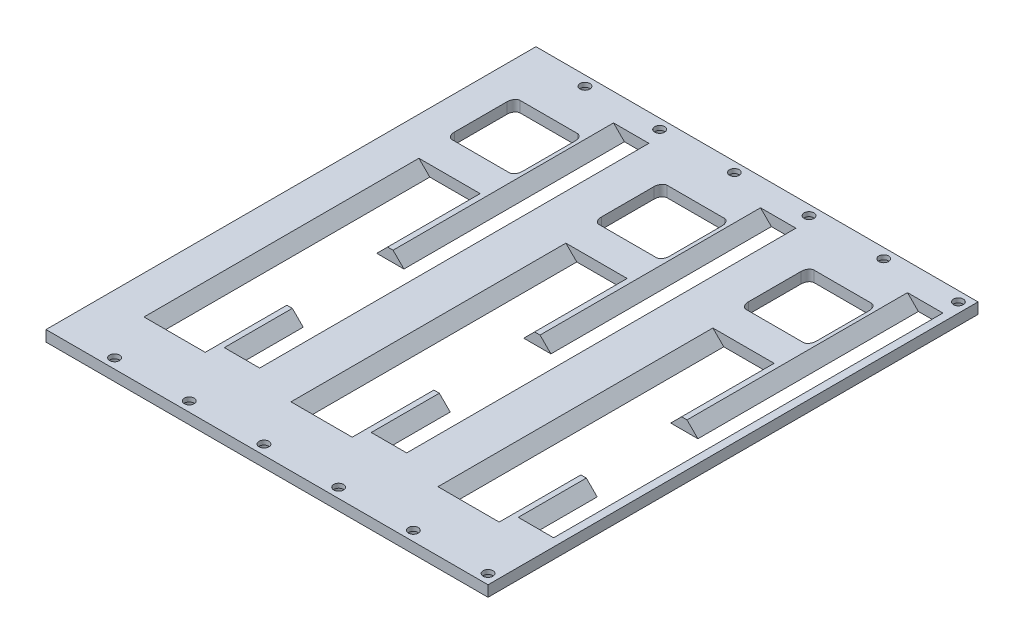
from build123d import *

# Parameters (mm, degrees)
SZKIC1_W                                          = 162.4
SZKIC1_H                                          = 180
DODANIE_WYCI_GNI_CIE1_DEPTH                       = 4
WYTNIJ_WYCI_GNI_CIE1_REACH                        = 123.282
SFAZOWANIE1_SIZE                                  = 4
POG_BIENIE_WALCOWE_POD_M3_RUB_Z_BEM_S_D           = 3.6
POG_BIENIE_WALCOWE_POD_M3_RUB_Z_BEM_S_DEPTH       = 6.7
POG_BIENIE_WALCOWE_POD_M3_RUB_Z_BEM_S_CBORE_D     = 7
POG_BIENIE_WALCOWE_POD_M3_RUB_Z_BEM_S_CBORE_DEPTH = 2.4
POG_BIENIE_WALCOWE_POD_M3_RUB_Z_BEM_S_TIP         = 1.081549114


with BuildPart() as part:
    # Szkic1 → Dodanie-wyciągnięcie1 (new body)
    with BuildSketch(Plane(origin=(0, 0, 0), x_dir=(1, 0, 0), z_dir=(0, 1, 0))):
        Rectangle(SZKIC1_W, SZKIC1_H)
    extrude(amount=DODANIE_WYCI_GNI_CIE1_DEPTH)

    # Szkic2 → Wytnij-wyciągnięcie1 (cut, up to next)
    with BuildSketch(Plane.XZ, mode=Mode.PRIVATE) as wytnij_wyci_gni_cie1_sk1:
        with BuildLine():
            Line((-44, -47.828427125), (-44, -67.171572875))
            add(Edge.make_bspline(
                [(-46, -70), (-44, -70), (-44, -67.171572875)],
                knots=[3.141592654, 3.141592654, 3.141592654, 4.71238898, 4.71238898, 4.71238898], degree=2, weights=[1, 0.707106781, 1]))
            Line((-46, -70), (-67, -70))
            add(Edge.make_bspline(
                [(-69, -67.171572875), (-69, -70), (-67, -70)],
                knots=[1.570796327, 1.570796327, 1.570796327, 3.141592654, 3.141592654, 3.141592654], degree=2, weights=[1, 0.707106781, 1]))
            Line((-69, -67.171572875), (-69, -47.828427125))
            add(Edge.make_bspline(
                [(-67, -45), (-69, -45), (-69, -47.828427125)],
                knots=[0, 0, 0, 1.570796327, 1.570796327, 1.570796327], degree=2, weights=[1, 0.707106781, 1]))
            Line((-67, -45), (-46, -45))
            add(Edge.make_bspline(
                [(-44, -47.828427125), (-44, -45), (-46, -45)],
                knots=[4.71238898, 4.71238898, 4.71238898, 6.283185307, 6.283185307, 6.283185307], degree=2, weights=[1, 0.707106781, 1]))
        make_face()
    wytnij_wyci_gni_cie1_tool1 = extrude(wytnij_wyci_gni_cie1_sk1.sketch, amount=-WYTNIJ_WYCI_GNI_CIE1_REACH, mode=Mode.PRIVATE) & part.part
    # Szkic2 → Wytnij-wyciągnięcie1 (cut, up to next)
    with BuildSketch(Plane.XZ, mode=Mode.PRIVATE) as wytnij_wyci_gni_cie1_sk2:
        with BuildLine():
            Line((10, -47.828427125), (10, -67.171572875))
            add(Edge.make_bspline(
                [(8, -70), (10, -70), (10, -67.171572875)],
                knots=[3.141592654, 3.141592654, 3.141592654, 4.71238898, 4.71238898, 4.71238898], degree=2, weights=[1, 0.707106781, 1]))
            Line((8, -70), (-13, -70))
            add(Edge.make_bspline(
                [(-15, -67.171572875), (-15, -70), (-13, -70)],
                knots=[1.570796327, 1.570796327, 1.570796327, 3.141592654, 3.141592654, 3.141592654], degree=2, weights=[1, 0.707106781, 1]))
            Line((-15, -67.171572875), (-15, -47.828427125))
            add(Edge.make_bspline(
                [(-13, -45), (-15, -45), (-15, -47.828427125)],
                knots=[0, 0, 0, 1.570796327, 1.570796327, 1.570796327], degree=2, weights=[1, 0.707106781, 1]))
            Line((-13, -45), (8, -45))
            add(Edge.make_bspline(
                [(10, -47.828427125), (10, -45), (8, -45)],
                knots=[4.71238898, 4.71238898, 4.71238898, 6.283185307, 6.283185307, 6.283185307], degree=2, weights=[1, 0.707106781, 1]))
        make_face()
    wytnij_wyci_gni_cie1_tool2 = extrude(wytnij_wyci_gni_cie1_sk2.sketch, amount=-WYTNIJ_WYCI_GNI_CIE1_REACH, mode=Mode.PRIVATE) & part.part
    # Szkic2 → Wytnij-wyciągnięcie1 (cut, up to next)
    with BuildSketch(Plane.XZ, mode=Mode.PRIVATE) as wytnij_wyci_gni_cie1_sk3:
        Polygon((-9.2, -33), (5.3, -33), (5.3, 1), (15.3, 1), (15.3, -80), (20.3, -80), (20.3, 63), (15.3, 63), (15.3, 38), (5.3, 38), (5.3, 68), (-9.2, 68), align=None)
    wytnij_wyci_gni_cie1_tool3 = extrude(wytnij_wyci_gni_cie1_sk3.sketch, amount=-WYTNIJ_WYCI_GNI_CIE1_REACH, mode=Mode.PRIVATE) & part.part
    # Szkic2 → Wytnij-wyciągnięcie1 (cut, up to next)
    with BuildSketch(Plane.XZ, mode=Mode.PRIVATE) as wytnij_wyci_gni_cie1_sk4:
        Polygon((-63.2, -33), (-48.7, -33), (-48.7, 1), (-38.7, 1), (-38.7, -80), (-33.7, -80), (-33.7, 63), (-38.7, 63), (-38.7, 38), (-48.7, 38), (-48.7, 68), (-63.2, 68), align=None)
    wytnij_wyci_gni_cie1_tool4 = extrude(wytnij_wyci_gni_cie1_sk4.sketch, amount=-WYTNIJ_WYCI_GNI_CIE1_REACH, mode=Mode.PRIVATE) & part.part
    # Szkic2 → Wytnij-wyciągnięcie1 (cut, up to next)
    with BuildSketch(Plane.XZ, mode=Mode.PRIVATE) as wytnij_wyci_gni_cie1_sk5:
        with BuildLine():
            Line((64, -47.828427125), (64, -67.171572875))
            add(Edge.make_bspline(
                [(62, -70), (64, -70), (64, -67.171572875)],
                knots=[3.141592654, 3.141592654, 3.141592654, 4.71238898, 4.71238898, 4.71238898], degree=2, weights=[1, 0.707106781, 1]))
            Line((62, -70), (41, -70))
            add(Edge.make_bspline(
                [(39, -67.171572875), (39, -70), (41, -70)],
                knots=[1.570796327, 1.570796327, 1.570796327, 3.141592654, 3.141592654, 3.141592654], degree=2, weights=[1, 0.707106781, 1]))
            Line((39, -67.171572875), (39, -47.828427125))
            add(Edge.make_bspline(
                [(41, -45), (39, -45), (39, -47.828427125)],
                knots=[0, 0, 0, 1.570796327, 1.570796327, 1.570796327], degree=2, weights=[1, 0.707106781, 1]))
            Line((41, -45), (62, -45))
            add(Edge.make_bspline(
                [(64, -47.828427125), (64, -45), (62, -45)],
                knots=[4.71238898, 4.71238898, 4.71238898, 6.283185307, 6.283185307, 6.283185307], degree=2, weights=[1, 0.707106781, 1]))
        make_face()
    wytnij_wyci_gni_cie1_tool5 = extrude(wytnij_wyci_gni_cie1_sk5.sketch, amount=-WYTNIJ_WYCI_GNI_CIE1_REACH, mode=Mode.PRIVATE) & part.part
    # Szkic2 → Wytnij-wyciągnięcie1 (cut, up to next)
    with BuildSketch(Plane.XZ, mode=Mode.PRIVATE) as wytnij_wyci_gni_cie1_sk6:
        Polygon((44.8, -33), (59.3, -33), (59.3, 1), (69.3, 1), (69.3, -80), (74.3, -80), (74.3, 63), (69.3, 63), (69.3, 38), (59.3, 38), (59.3, 68), (44.8, 68), align=None)
    wytnij_wyci_gni_cie1_tool6 = extrude(wytnij_wyci_gni_cie1_sk6.sketch, amount=-WYTNIJ_WYCI_GNI_CIE1_REACH, mode=Mode.PRIVATE) & part.part
    add(wytnij_wyci_gni_cie1_tool1.solids().sort_by_distance((-56.5, 0, -57.5))[0], mode=Mode.SUBTRACT)
    add(wytnij_wyci_gni_cie1_tool2.solids().sort_by_distance((-2.5, 0, -57.5))[0], mode=Mode.SUBTRACT)
    add(wytnij_wyci_gni_cie1_tool3.solids().sort_by_distance((5.366631, 0, 10.498627))[0], mode=Mode.SUBTRACT)
    add(wytnij_wyci_gni_cie1_tool4.solids().sort_by_distance((-48.633369, 0, 10.498627))[0], mode=Mode.SUBTRACT)
    add(wytnij_wyci_gni_cie1_tool5.solids().sort_by_distance((51.5, 0, -57.5))[0], mode=Mode.SUBTRACT)
    add(wytnij_wyci_gni_cie1_tool6.solids().sort_by_distance((59.366631, 0, 10.498627))[0], mode=Mode.SUBTRACT)

    # Sfazowanie1
    sfazowanie1_edges = [part.edges().sort_by_distance(p)[0] for p in [
        (69.3, 4, -39.5),
        (74.3, 4, -8.5),
        (69.3, 4, 50.5),
        (59.3, 4, 53),
        (59.3, 4, -16),
        (44.8, 4, 17.5),
        (15.3, 4, -39.5),
        (15.3, 4, 50.5),
        (20.3, 4, -8.5),
        (5.3, 4, 53),
        (5.3, 4, -16),
        (-9.2, 4, 17.5),
        (-33.7, 4, -8.5),
        (-38.7, 4, -39.5),
        (-38.7, 4, 50.5),
        (-48.7, 4, 53),
        (-48.7, 4, -16),
        (-63.2, 4, 17.5),
    ]]
    chamfer(sfazowanie1_edges, length=SFAZOWANIE1_SIZE - 0.0001)  # a hair under: the kernel refuses the full size

    # Pogłębienie walcowe pod M3 Śrubę z łbem stożkowym ściętym1
    with Locations(Plane.XZ):
        with Locations((77.6, 86.4), (77.6, -86.4), (50.16, -86.4), (22.72, -86.4), (-4.72, -86.4), (-32.16, -86.4), (-59.6, -86.4), (-59.6, 86.4), (-32.16, 86.4), (-4.72, 86.4), (22.72, 86.4), (50.16, 86.4)):
            CounterBoreHole(POG_BIENIE_WALCOWE_POD_M3_RUB_Z_BEM_S_D / 2, POG_BIENIE_WALCOWE_POD_M3_RUB_Z_BEM_S_CBORE_D / 2, POG_BIENIE_WALCOWE_POD_M3_RUB_Z_BEM_S_CBORE_DEPTH, depth=POG_BIENIE_WALCOWE_POD_M3_RUB_Z_BEM_S_DEPTH)
            with Locations((0, 0, -(POG_BIENIE_WALCOWE_POD_M3_RUB_Z_BEM_S_DEPTH + POG_BIENIE_WALCOWE_POD_M3_RUB_Z_BEM_S_TIP / 2))):  # 118° drill point
                Cone(0, POG_BIENIE_WALCOWE_POD_M3_RUB_Z_BEM_S_D / 2, POG_BIENIE_WALCOWE_POD_M3_RUB_Z_BEM_S_TIP, mode=Mode.SUBTRACT)


solid = part.part
